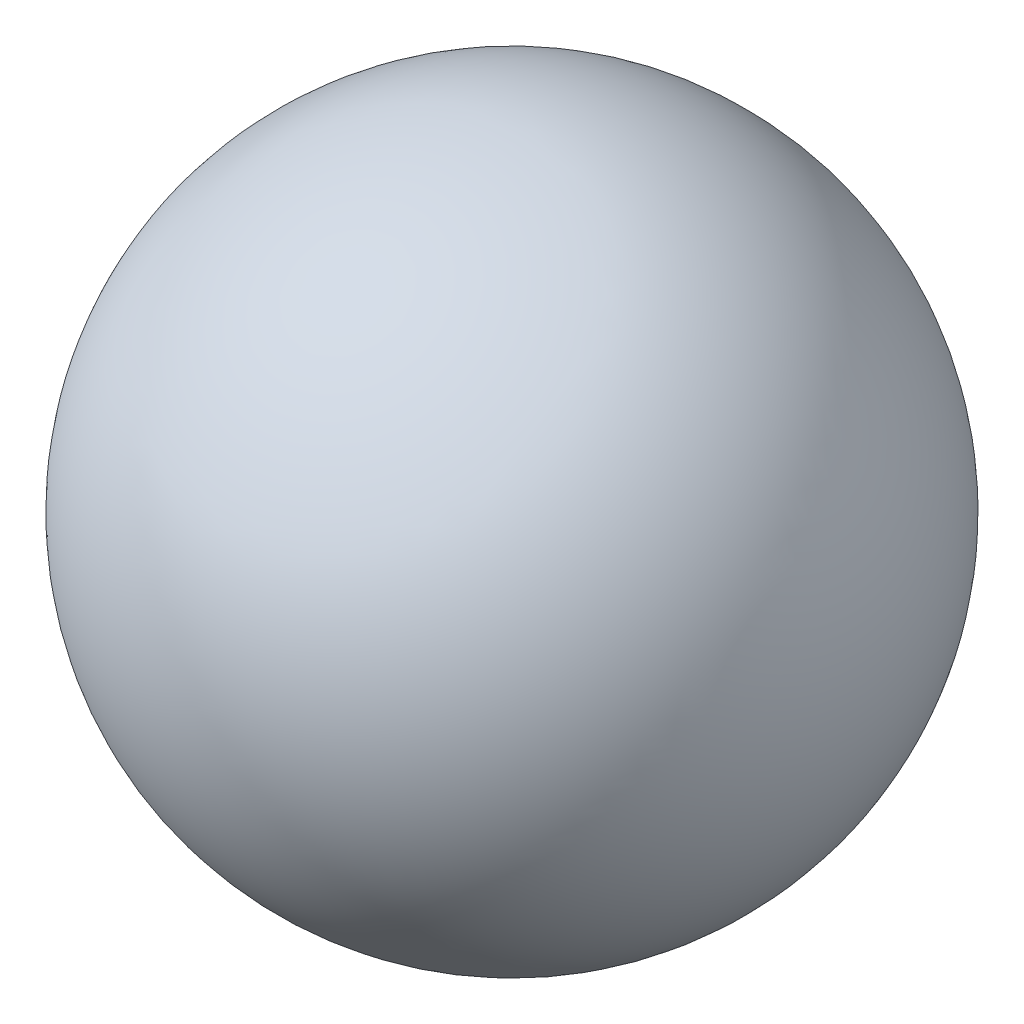
from build123d import *


with BuildPart() as part:
    # Esquisse1 → Révolution1 (revolve)
    with BuildSketch(Plane.XY):
        with BuildLine():
            ThreePointArc((2.5, 0), (0, 2.5), (-2.5, 0))
            Line((-2.5, 0), (2.5, 0))
        make_face()
    revolve(axis=Axis((-1000, 0, 0), (1, 0, 0)))


solid = part.part
